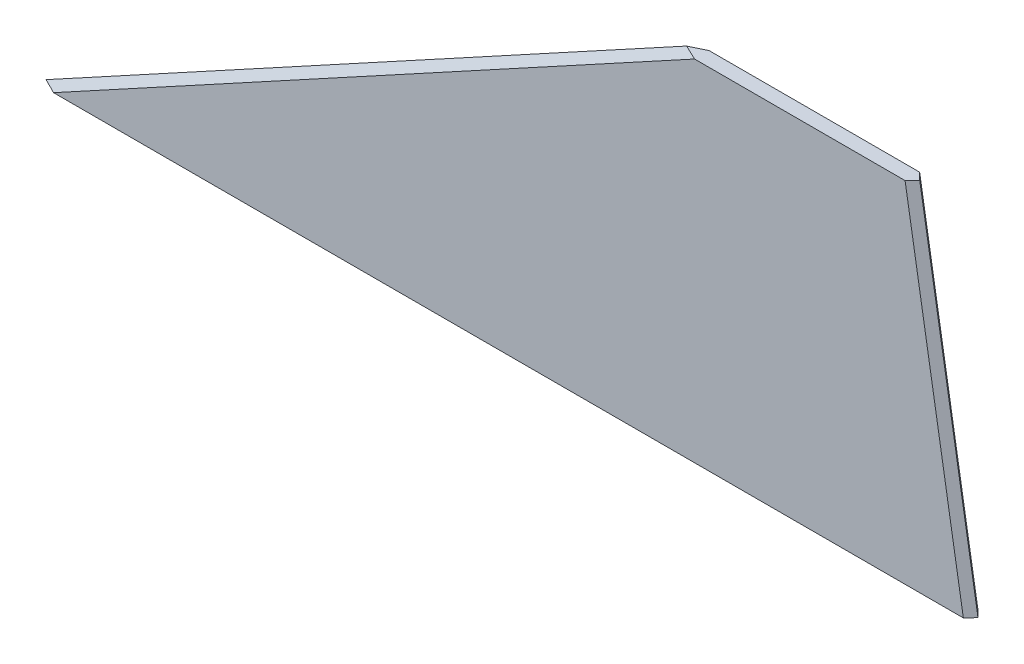
from build123d import *

# Parameters (mm, degrees)
BOSS_EXTRUDE1_DEPTH     = 6.35
CHAMFER1_SIZE           = 3.175
CUT_EXTRUDE1_DEPTH      = 421.64
CUT_EXTRUDE1_DEPTH_BACK = 27.432
SKETCH2_R               = 50.8


with BuildPart() as part:
    # Sketch1 → Boss-Extrude1 (new body)
    with BuildSketch(Plane.XY):
        Polygon((279.4, 152.4), (0, 0), (279.4, 0), align=None)
        Polygon((279.4, 152.4), (279.4, 0), (406.4, 0), (381, 152.4), align=None)
    extrude(amount=BOSS_EXTRUDE1_DEPTH)

    # Chamfer1
    chamfer1_edges = [part.edges().sort_by_distance(p)[0] for p in [
        (393.7, 76.2, 6.35),
        (393.7, 76.2, 0),
        (139.7, 76.2, 0),
        (139.7, 76.2, 6.35),
    ]]
    chamfer(chamfer1_edges, length=CHAMFER1_SIZE - 0.0001)  # a hair under: the kernel refuses the full size

    # Sketch2 → Cut-Extrude1 (cut, two sides: drawn at the far end of the back side and taken through both)
    with BuildSketch(Plane(origin=(0, 0, 0), x_dir=(0, 0, -1), z_dir=(1, 0, 0)).offset(-CUT_EXTRUDE1_DEPTH_BACK)):
        with Locations((-3.175, -50.700684167)):
            Circle(SKETCH2_R)
    extrude(amount=CUT_EXTRUDE1_DEPTH + CUT_EXTRUDE1_DEPTH_BACK, mode=Mode.SUBTRACT)


solid = part.part
